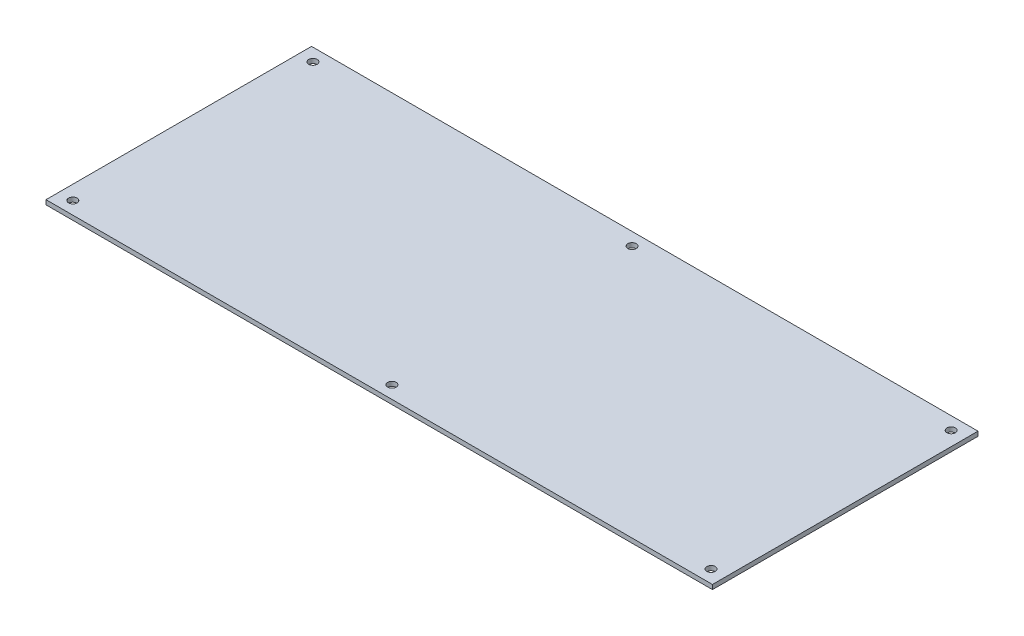
from build123d import *

# Parameters (mm, degrees)
SKETCH1_W               = 471.83
SKETCH1_H               = 188
BASE_FLANGE2_DEPTH      = 3.18
CUT_EXTRUDE1_DEPTH      = 254.972438711
CUT_EXTRUDE1_DEPTH_BACK = 254.972438711
SKETCH2_R               = 3


# Sheet-metal steps are written as plain solids
with BuildPart() as part:
    # Sketch1 → Base-Flange2 (new body)
    with BuildSketch(Plane(origin=(0, 0, 0), x_dir=(1, 0, 0), z_dir=(0, 1, 0))):
        Rectangle(SKETCH1_W, SKETCH1_H)
    extrude(amount=-BASE_FLANGE2_DEPTH)

    # Sketch2 → Cut-Extrude1 (cut, two sides: drawn at the far end of the back side and taken through both)
    with BuildSketch(Plane.XZ.offset(3.18).offset(-CUT_EXTRUDE1_DEPTH_BACK)):
        with Locations(Location((-225.915, 85, 0), (0, 0, 270))):
            Circle(SKETCH2_R)
        with Locations(Location((-225.915, -85, 0), (0, 0, 270))):
            Circle(SKETCH2_R)
        with Locations(Location((225.915, -85, 0), (0, 0, 270))):
            Circle(SKETCH2_R)
        with Locations(Location((225.915, 85, 0), (0, 0, 270))):
            Circle(SKETCH2_R)
        with Locations(Location((0, 85, 0), (0, 0, 270))):
            Circle(SKETCH2_R)
        with Locations(Location((0, -85, 0), (0, 0, 270))):
            Circle(SKETCH2_R)
    extrude(amount=CUT_EXTRUDE1_DEPTH + CUT_EXTRUDE1_DEPTH_BACK, mode=Mode.SUBTRACT)


solid = part.part
